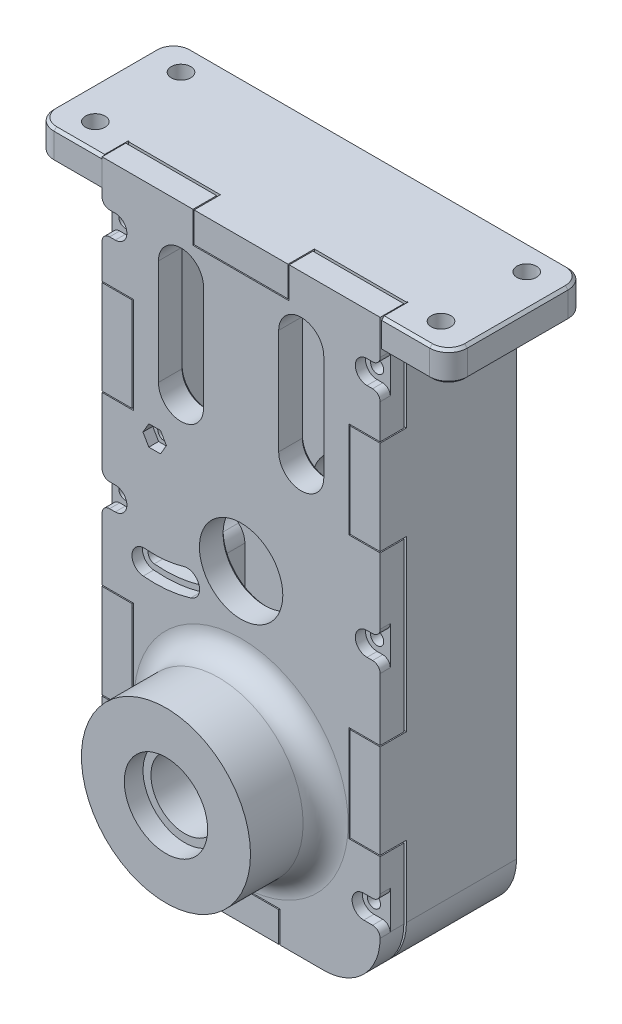
from build123d import *

# Parameters (mm, degrees)
SKETCH1_W            = 42
SKETCH1_H            = 42
BOSS_EXTRUDE1_DEPTH  = 7
SKETCH3_W            = 74
SKETCH3_H            = 158
SKETCH3_W_2          = 58
SKETCH3_H_2          = 142
BOSS_EXTRUDE2_DEPTH  = 30
CUT_EXTRUDE2_REACH   = 138.158
SKETCH4_R            = 9
SKETCH4_5_R          = 11.1
CUT_EXTRUDE3_DEPTH   = 5
CUT_EXTRUDE21_START  = 2
SKETCH4_6_R          = 11.1
SKETCH4_6_R_2        = 9
CUT_EXTRUDE21_DEPTH  = 5
SKETCH5_W            = 8
SKETCH5_H            = 25
SKETCH5_W_2          = 20
SKETCH5_H_2          = 8
SKETCH5_W_3          = 25
BOSS_EXTRUDE4_DEPTH  = 7
BOSS_EXTRUDE5_DEPTH  = 7
BOSS_EXTRUDE15_START = 20
SKETCH28_R           = 22.5
SKETCH28_R_2         = 9
BOSS_EXTRUDE15_DEPTH = 20
CUT_EXTRUDE4_START   = -27
SKETCH8_R            = 9
SKETCH8_R_2          = 11.1
CUT_EXTRUDE4_DEPTH   = 7
SKETCH8_3_R          = 11.1
SKETCH8_3_R_2        = 9
CUT_EXTRUDE5_DEPTH   = 5
SKETCH9_R            = 1.8
CUT_EXTRUDE7_DEPTH   = 7
CUT_EXTRUDE8_DEPTH   = 2.8
CUT_EXTRUDE9_DEPTH   = 2.6
CUT_EXTRUDE10_DEPTH  = 23
FILLET3_R            = 15
FILLET4_R            = 7
FILLET5_R            = 15
SKETCH14_R           = 1.75
CUT_EXTRUDE11_DEPTH  = 2.7
SKETCH14_2_R         = 1.75
CUT_EXTRUDE12_DEPTH  = 7
SKETCH15_R           = 1.5
CUT_EXTRUDE13_DEPTH  = 16
CUT_EXTRUDE14_DEPTH  = 7
FILLET6_R            = 2
SKETCH17_W           = 110
SKETCH17_H           = 29.8
BOSS_EXTRUDE8_DEPTH  = 8
SKETCH18_W           = 17.8
SKETCH18_H           = 8
BOSS_EXTRUDE10_DEPTH = 7
SKETCH19_R           = 2.6
CUT_EXTRUDE15_DEPTH  = 2.5
SKETCH19_3_R         = 2.6
CUT_EXTRUDE16_DEPTH  = 170.629006953
FILLET7_R            = 5
CHAMFER1_SIZE        = 0.7
CHAMFER2_SIZE        = 0.7
FILLET8_R            = 5
FILLET12_R           = 6


with BuildPart() as part:
    # Sketch1 → Boss-Extrude1 (new body)
    # profile 1 of 2: a face of its own
    with BuildSketch(Plane.XY):
        Polygon((21, -21), (-21, -21), (-21, 21), (-29, 21), (-29, -121), (29, -121), (29, 21), (21, 21), align=None)
    # profile 2 of 2: a face of its own
    with BuildSketch(Plane.XY):
        Rectangle(SKETCH1_W, SKETCH1_H)
        with BuildLine():
            ThreePointArc((11.1, 3.5), (0, 14.6), (-11.1, 3.5))
            Line((-11.1, 3.5), (-11.1, -3.5))
            ThreePointArc((-11.1, -3.5), (0, -14.6), (11.1, -3.5))
            Line((11.1, -3.5), (11.1, 3.5))
        make_face(mode=Mode.SUBTRACT)
        with BuildLine():
            ThreePointArc((17.3, -12), (15.5, -10.2), (13.7, -12))
            Line((13.7, -12), (13.7, -19))
            ThreePointArc((13.7, -19), (15.5, -20.8), (17.3, -19))
            Line((17.3, -19), (17.3, -12))
        make_face(mode=Mode.SUBTRACT)
        with BuildLine():
            ThreePointArc((-13.7, -12), (-15.5, -10.2), (-17.3, -12))
            Line((-17.3, -12), (-17.3, -19))
            ThreePointArc((-17.3, -19), (-15.5, -20.8), (-13.7, -19))
            Line((-13.7, -19), (-13.7, -12))
        make_face(mode=Mode.SUBTRACT)
        with BuildLine():
            ThreePointArc((-13.7, 19), (-15.5, 20.8), (-17.3, 19))
            Line((-17.3, 19), (-17.3, 12))
            ThreePointArc((-17.3, 12), (-15.5, 10.2), (-13.7, 12))
            Line((-13.7, 12), (-13.7, 19))
        make_face(mode=Mode.SUBTRACT)
        with BuildLine():
            ThreePointArc((17.3, 19), (15.5, 20.8), (13.7, 19))
            Line((13.7, 19), (13.7, 12))
            ThreePointArc((13.7, 12), (15.5, 10.2), (17.3, 12))
            Line((17.3, 12), (17.3, 19))
        make_face(mode=Mode.SUBTRACT)
    extrude(amount=BOSS_EXTRUDE1_DEPTH)

    # Sketch3 → Boss-Extrude2 (add)
    with BuildSketch(Plane.XY):
        with Locations((0, -50)):
            Rectangle(SKETCH3_W, SKETCH3_H)
        with Locations((0, -50)):
            Rectangle(SKETCH3_W_2, SKETCH3_H_2, mode=Mode.SUBTRACT)
    extrude(amount=BOSS_EXTRUDE2_DEPTH)

    # Sketch4 → Cut-Extrude2 (cut, up to next)
    with BuildSketch(Plane(origin=(0, 0, 7), x_dir=(-1, 0, 0), z_dir=(0, 0, -1)), mode=Mode.PRIVATE) as cut_extrude2_sk1:
        with Locations(Location((0, -92, 0), (0, 0, 180))):
            Circle(SKETCH4_R)
    cut_extrude2_tool1 = extrude(cut_extrude2_sk1.sketch, amount=CUT_EXTRUDE2_REACH, mode=Mode.PRIVATE) & part.part
    # Sketch4 → Cut-Extrude2 (cut, up to next)
    with BuildSketch(Plane(origin=(0, 0, 7), x_dir=(-1, 0, 0), z_dir=(0, 0, -1)), mode=Mode.PRIVATE) as cut_extrude2_sk2:
        with Locations(Location((0, -48, 0), (0, 0, 180))):
            Circle(SKETCH4_R)
    cut_extrude2_tool2 = extrude(cut_extrude2_sk2.sketch, amount=CUT_EXTRUDE2_REACH, mode=Mode.PRIVATE) & part.part
    add(cut_extrude2_tool1.solids().sort_by_distance((0, -92, 7))[0], mode=Mode.SUBTRACT)
    add(cut_extrude2_tool2.solids().sort_by_distance((0, -48, 7))[0], mode=Mode.SUBTRACT)

    # Sketch4<5> → Cut-Extrude3 (cut)
    with BuildSketch(Plane(origin=(0, 0, 7), x_dir=(-1, 0, 0), z_dir=(0, 0, -1))):
        with Locations((0, -48)):
            Circle(SKETCH4_5_R)
    extrude(amount=CUT_EXTRUDE3_DEPTH, mode=Mode.SUBTRACT)

    # Sketch4<6> → Cut-Extrude21 (cut)
    with BuildSketch(Plane(origin=(0, 0, 7), x_dir=(-1, 0, 0), z_dir=(0, 0, -1)).offset(CUT_EXTRUDE21_START)):
        with Locations(Location((0, -92, 0), (0, 0, 180))):
            Circle(SKETCH4_6_R)
        with Locations(Location((0, -92, 0), (0, 0, 180))):
            Circle(SKETCH4_6_R_2, mode=Mode.SUBTRACT)
    extrude(amount=CUT_EXTRUDE21_DEPTH, mode=Mode.SUBTRACT)

    # Sketch5 → Boss-Extrude4 (add)
    with BuildSketch(Plane.XY.offset(30)):
        with Locations((-33, -12.5)):
            Rectangle(SKETCH5_W, SKETCH5_H)
        with Locations((-33, -82.5)):
            Rectangle(SKETCH5_W, SKETCH5_H)
        with Locations((0, -125)):
            Rectangle(SKETCH5_W_2, SKETCH5_H_2)
        with Locations((33, -82.5)):
            Rectangle(SKETCH5_W, SKETCH5_H)
        with Locations((33, -12.5)):
            Rectangle(SKETCH5_W, SKETCH5_H)
        with Locations((0, 25)):
            Rectangle(SKETCH5_W_3, SKETCH5_H_2)
    extrude(amount=BOSS_EXTRUDE4_DEPTH)

    # Sketch12 → Cut-Extrude10 (cut)
    with BuildSketch(Plane.XY.offset(30)):
        with BuildLine():
            Line((-29, -49.5), (-29, -68.5))
            ThreePointArc((-29, -68.5), (-34.454731747, -59), (-29, -49.5))
        make_face()
    extrude(amount=-CUT_EXTRUDE10_DEPTH, mode=Mode.SUBTRACT)

    # Fillet3
    fillet3_edges = [part.edges().sort_by_distance(p)[0] for p in [
        (37, -129, 15),
        (-37, -129, 15),
    ]]
    fillet(fillet3_edges, radius=FILLET3_R)

    # Fillet4
    fillet4_edges = [part.edges().sort_by_distance(p)[0] for p in [
        (-29, -121, 18.5),
        (29, -121, 18.5),
    ]]
    fillet(fillet4_edges, radius=FILLET4_R)

    # Sketch15 → Cut-Extrude13 (cut)
    with BuildSketch(Plane.XY.offset(37)):
        with Locations((33.5, 14.65)):
            Circle(SKETCH15_R)
        with Locations((33.5, -48)):
            Circle(SKETCH15_R)
        with Locations((32.642135624, -109)):
            Circle(SKETCH15_R)
        with Locations((-32.642135624, -109)):
            Circle(SKETCH15_R)
        with Locations((-33.5, -48)):
            Circle(SKETCH15_R)
        with Locations((-33.5, 14.65)):
            Circle(SKETCH15_R)
    extrude(amount=-CUT_EXTRUDE13_DEPTH, mode=Mode.SUBTRACT)

    # Sketch17 → Boss-Extrude8 (add)
    with BuildSketch(Plane(origin=(0, 29, 0), x_dir=(1, 0, 0), z_dir=(0, 1, 0))):
        with Locations((0, -14.9)):
            Rectangle(SKETCH17_W, SKETCH17_H)
    extrude(amount=-BOSS_EXTRUDE8_DEPTH)

    # Sketch18 → Boss-Extrude10 (add)
    with BuildSketch(Plane.XY.offset(29.8)):
        with Locations((-46.1, 25)):
            Rectangle(SKETCH18_W, SKETCH18_H)
        with Locations((46.1, 25)):
            Rectangle(SKETCH18_W, SKETCH18_H)
    extrude(amount=BOSS_EXTRUDE10_DEPTH)

    # Sketch19 → Cut-Extrude15 (cut)
    # profile 1 of 4: a face of its own
    with BuildSketch(Plane.XZ.offset(-21)):
        Polygon((40.457437416, 29.8), (43.228718708, 34.6), (48.771281292, 34.6), (51.542562584, 29.8), (48.771281292, 25), (43.228718708, 25), align=None)
        with Locations(Location((46, 29.8, 0), (0, 0, 270))):
            Circle(SKETCH19_R, mode=Mode.SUBTRACT)
    # profile 2 of 4: a face of its own
    with BuildSketch(Plane.XZ.offset(-21)):
        Polygon((43.228718708, 11.8), (48.771281292, 11.8), (51.542562584, 7), (48.771281292, 2.2), (43.228718708, 2.2), (40.457437416, 7), align=None)
        with Locations(Location((46, 7, 0), (0, 0, 270))):
            Circle(SKETCH19_R, mode=Mode.SUBTRACT)
    # profile 3 of 4: a face of its own
    with BuildSketch(Plane.XZ.offset(-21)):
        Polygon((-43.228718708, 2.2), (-40.457437416, 7), (-43.228718708, 11.8), (-48.771281292, 11.8), (-51.542562584, 7), (-48.771281292, 2.2), align=None)
        with Locations(Location((-46, 7, 0), (0, 0, 270))):
            Circle(SKETCH19_R, mode=Mode.SUBTRACT)
    # profile 4 of 4: a face of its own
    with BuildSketch(Plane.XZ.offset(-21)):
        Polygon((-48.771281292, 25), (-43.228718708, 25), (-40.457437416, 29.8), (-43.228718708, 34.6), (-48.771281292, 34.6), (-51.542562584, 29.8), align=None)
        with Locations(Location((-46, 29.8, 0), (0, 0, 270))):
            Circle(SKETCH19_R, mode=Mode.SUBTRACT)
    extrude(amount=-CUT_EXTRUDE15_DEPTH, mode=Mode.SUBTRACT)

    # Sketch19<3> → Cut-Extrude16 (cut, through all)
    with BuildSketch(Plane.XZ.offset(-21)):
        with Locations(Location((-46, 29.8, 0), (0, 0, 270))):
            Circle(SKETCH19_3_R)
        with Locations(Location((-46, 7, 0), (0, 0, 270))):
            Circle(SKETCH19_3_R)
        with Locations(Location((46, 7, 0), (0, 0, 270))):
            Circle(SKETCH19_3_R)
        with Locations(Location((46, 29.8, 0), (0, 0, 270))):
            Circle(SKETCH19_3_R)
    extrude(amount=-CUT_EXTRUDE16_DEPTH, mode=Mode.SUBTRACT)

    # Fillet7
    fillet7_edges = [part.edges().sort_by_distance(p)[0] for p in [
        (-55, 25, 0),
        (55, 25, 0),
        (55, 25, 36.8),
        (-55, 25, 36.8),
    ]]
    fillet(fillet7_edges, radius=FILLET7_R)

    # Chamfer1
    chamfer1_edges = [part.edges().sort_by_distance(p)[0] for p in [
        (-9, -48, 0),
        (-11.1, -92, 0),
        (37, -46.5, 0),
        (0, -129, 0),
        (-32.606601718, -124.606601718, 0),
        (32.606601718, -124.606601718, 0),
        (-37, -46.5, 0),
        (-43.5, 21, 0),
        (13.7, 15.5, 0),
        (15.5, 10.2, 0),
        (17.3, 15.5, 0),
        (43.6, 21, 36.8),
        (15.5, 20.8, 0),
        (-17.3, 15.5, 0),
        (-43.6, 29, 36.8),
        (-15.5, 10.2, 0),
        (-13.7, 15.5, 0),
        (-15.5, 20.8, 0),
        (-17.3, -15.5, 0),
        (-15.5, -20.8, 0),
        (-13.7, -15.5, 0),
        (-15.5, -10.2, 0),
        (13.7, -15.5, 0),
        (15.5, -20.8, 0),
        (17.3, -15.5, 0),
        (15.5, -10.2, 0),
        (-11.1, 0, 0),
        (0, -14.6, 0),
        (11.1, 0, 0),
        (0, 14.6, 0),
        (55, 29, 18.4),
        (55, 21, 18.4),
        (43.6, 29, 36.8),
        (0, 29, 0),
        (-55, 29, 18.4),
        (-53.535533906, 29, 35.335533906),
        (-53.535533906, 29, 1.464466094),
        (53.535533906, 29, 35.335533906),
        (53.535533906, 29, 1.464466094),
        (43.5, 21, 0),
        (53.535533906, 21, 35.335533906),
        (53.535533906, 21, 1.464466094),
        (-55, 21, 18.4),
        (-43.6, 21, 36.8),
        (-53.535533906, 21, 35.335533906),
        (-53.535533906, 21, 1.464466094),
    ]]
    chamfer(chamfer1_edges, length=CHAMFER1_SIZE)

    # Fillet8
    fillet8_edges = [part.edges().sort_by_distance(p)[0] for p in [
        (-29, -49.5, 18.5),
        (-29, -68.5, 18.5),
    ]]
    fillet(fillet8_edges, radius=FILLET8_R)


with BuildPart() as body_2:
    # Sketch7 → Boss-Extrude5 (new body)
    with BuildSketch(Plane.XY.offset(30)):
        Polygon((-37, -129), (-10.3, -129), (-10.3, -120.7), (10.3, -120.7), (10.3, -129), (37, -129), (37, -95.3), (28.7, -95.3), (28.7, -69.7), (37, -69.7), (37, -25.3), (28.7, -25.3), (28.7, 0.3), (37, 0.3), (37, 29), (12.8, 29), (12.8, 20.7), (-12.8, 20.7), (-12.8, 29), (-37, 29), (-37, 0.3), (-28.7, 0.3), (-28.7, -25.3), (-37, -25.3), (-37, -69.7), (-28.7, -69.7), (-28.7, -95.3), (-37, -95.3), align=None)
    extrude(amount=BOSS_EXTRUDE5_DEPTH)

    # Sketch28 → Boss-Extrude15 (add)
    with BuildSketch(Plane.XY.offset(37).offset(BOSS_EXTRUDE15_START)):
        with Locations((0, -92)):
            Circle(SKETCH28_R)
        with Locations((0, -92)):
            Circle(SKETCH28_R_2, mode=Mode.SUBTRACT)
    extrude(amount=-BOSS_EXTRUDE15_DEPTH)

    # Sketch8 → Cut-Extrude4 (cut)
    with BuildSketch(Plane.XY.offset(57).offset(CUT_EXTRUDE4_START)):
        with Locations((0, -92)):
            Circle(SKETCH8_R)
        with Locations((0, -48)):
            Circle(SKETCH8_R_2)
    extrude(amount=CUT_EXTRUDE4_DEPTH, mode=Mode.SUBTRACT)

    # Sketch8<3> → Cut-Extrude5 (cut)
    with BuildSketch(Plane.XY.offset(57)):
        with Locations((0, -92)):
            Circle(SKETCH8_3_R)
        with Locations((0, -92)):
            Circle(SKETCH8_3_R_2, mode=Mode.SUBTRACT)
    extrude(amount=-CUT_EXTRUDE5_DEPTH, mode=Mode.SUBTRACT)

    # Sketch9 → Cut-Extrude7 (cut)
    with BuildSketch(Plane.XY.offset(37)):
        with BuildLine():
            ThreePointArc((-25.915736751, -60.666046157), (-19.82, -60.6406005), (-13.841114362, -59.452500946))
            ThreePointArc((-13.841114362, -59.452500946), (-12.635815382, -57.210346989), (-14.87796934, -56.005048009))
            ThreePointArc((-14.87796934, -56.005048009), (-20.18, -57.058645726), (-25.585653345, -57.081210743))
            ThreePointArc((-25.585653345, -57.081210743), (-27.543112755, -58.708586747), (-25.915736751, -60.666046157))
        make_face()
        with Locations((-23, -29)):
            Circle(SKETCH9_R)
    extrude(amount=-CUT_EXTRUDE7_DEPTH, mode=Mode.SUBTRACT)

    # Sketch10 → Cut-Extrude8 (cut)
    with BuildSketch(Plane.XY.offset(37)):
        with BuildLine():
            ThreePointArc((-26.053271504, -62.159727579), (-19.67, -62.133081656), (-13.409091455, -60.88893967))
            ThreePointArc((-13.409091455, -60.88893967), (-11.199376659, -56.778324081), (-15.309992247, -54.568609285))
            ThreePointArc((-15.309992247, -54.568609285), (-20.33, -55.566164571), (-25.448118593, -55.58752932))
            ThreePointArc((-25.448118593, -55.58752932), (-29.036794178, -58.571051994), (-26.053271504, -62.159727579))
        make_face()
    extrude(amount=-CUT_EXTRUDE8_DEPTH, mode=Mode.SUBTRACT)

    # Sketch11 → Cut-Extrude9 (cut)
    with BuildSketch(Plane.XY.offset(37)):
        Polygon((-21.441154273, -26.3), (-24.558845727, -26.3), (-26.117691454, -29), (-24.558845727, -31.7), (-21.441154273, -31.7), (-19.882308546, -29), align=None)
    extrude(amount=-CUT_EXTRUDE9_DEPTH, mode=Mode.SUBTRACT)

    # Fillet5
    fillet5_edges = [body_2.edges().sort_by_distance(p)[0] for p in [
        (37, -129, 33.5),
        (-37, -129, 33.5),
    ]]
    fillet(fillet5_edges, radius=FILLET5_R)

    # Sketch14 → Cut-Extrude11 (cut)
    # profile 1 of 6: a face of its own
    with BuildSketch(Plane.XY.offset(37)):
        with BuildLine():
            Line((33.5, -44.9), (40.5, -44.9))
            ThreePointArc((40.5, -44.9), (43.6, -48), (40.5, -51.1))
            Line((40.5, -51.1), (33.5, -51.1))
            ThreePointArc((33.5, -51.1), (30.4, -48), (33.5, -44.9))
        make_face()
        with Locations((33.5, -48)):
            Circle(SKETCH14_R, mode=Mode.SUBTRACT)
    # profile 2 of 6: a face of its own
    with BuildSketch(Plane.XY.offset(37)):
        with BuildLine():
            Line((32.642135624, -105.9), (39.642135624, -105.9))
            ThreePointArc((39.642135624, -105.9), (42.742135624, -109), (39.642135624, -112.1))
            Line((39.642135624, -112.1), (32.642135624, -112.1))
            ThreePointArc((32.642135624, -112.1), (29.542135624, -109), (32.642135624, -105.9))
        make_face()
        with Locations((32.642135624, -109)):
            Circle(SKETCH14_R, mode=Mode.SUBTRACT)
    # profile 3 of 6: a face of its own
    with BuildSketch(Plane.XY.offset(37)):
        with BuildLine():
            Line((-33.5, -44.9), (-40.5, -44.9))
            ThreePointArc((-40.5, -44.9), (-43.6, -48), (-40.5, -51.1))
            Line((-40.5, -51.1), (-33.5, -51.1))
            ThreePointArc((-33.5, -51.1), (-30.4, -48), (-33.5, -44.9))
        make_face()
        with Locations((-33.5, -48)):
            Circle(SKETCH14_R, mode=Mode.SUBTRACT)
    # profile 4 of 6: a face of its own
    with BuildSketch(Plane.XY.offset(37)):
        with BuildLine():
            Line((33.5, 17.75), (40.5, 17.75))
            ThreePointArc((40.5, 17.75), (43.6, 14.65), (40.5, 11.55))
            Line((40.5, 11.55), (33.5, 11.55))
            ThreePointArc((33.5, 11.55), (30.4, 14.65), (33.5, 17.75))
        make_face()
        with Locations((33.5, 14.65)):
            Circle(SKETCH14_R, mode=Mode.SUBTRACT)
    # profile 5 of 6: a face of its own
    with BuildSketch(Plane.XY.offset(37)):
        with BuildLine():
            Line((-32.642135624, -105.9), (-39.642135624, -105.9))
            ThreePointArc((-39.642135624, -105.9), (-42.742135624, -109), (-39.642135624, -112.1))
            Line((-39.642135624, -112.1), (-32.642135624, -112.1))
            ThreePointArc((-32.642135624, -112.1), (-29.542135624, -109), (-32.642135624, -105.9))
        make_face()
        with Locations((-32.642135624, -109)):
            Circle(SKETCH14_R, mode=Mode.SUBTRACT)
    # profile 6 of 6: a face of its own
    with BuildSketch(Plane.XY.offset(37)):
        with BuildLine():
            Line((-33.5, 17.75), (-40.5, 17.75))
            ThreePointArc((-40.5, 17.75), (-43.6, 14.65), (-40.5, 11.55))
            Line((-40.5, 11.55), (-33.5, 11.55))
            ThreePointArc((-33.5, 11.55), (-30.4, 14.65), (-33.5, 17.75))
        make_face()
        with Locations((-33.5, 14.65)):
            Circle(SKETCH14_R, mode=Mode.SUBTRACT)
    extrude(amount=-CUT_EXTRUDE11_DEPTH, mode=Mode.SUBTRACT)

    # Sketch14<2> → Cut-Extrude12 (cut)
    with BuildSketch(Plane.XY.offset(37)):
        with Locations((-32.642135624, -109)):
            Circle(SKETCH14_2_R)
        with Locations((-33.5, -48)):
            Circle(SKETCH14_2_R)
        with Locations((-33.5, 14.65)):
            Circle(SKETCH14_2_R)
        with Locations((33.5, 14.65)):
            Circle(SKETCH14_2_R)
        with Locations((33.5, -48)):
            Circle(SKETCH14_2_R)
        with Locations((32.642135624, -109)):
            Circle(SKETCH14_2_R)
    extrude(amount=-CUT_EXTRUDE12_DEPTH, mode=Mode.SUBTRACT)

    # Sketch16 → Cut-Extrude14 (cut)
    with BuildSketch(Plane.XY.offset(37)):
        with BuildLine():
            Line((-10, 12.5), (-10, -15.5))
            ThreePointArc((-10, -15.5), (-16, -21.5), (-22, -15.5))
            Line((-22, -15.5), (-22, 12.5))
            ThreePointArc((-22, 12.5), (-16, 18.5), (-10, 12.5))
        make_face()
        with BuildLine():
            Line((10, 12.5), (10, -15.5))
            ThreePointArc((10, -15.5), (16, -21.5), (22, -15.5))
            Line((22, -15.5), (22, 12.5))
            ThreePointArc((22, 12.5), (16, 18.5), (10, 12.5))
        make_face()
    extrude(amount=-CUT_EXTRUDE14_DEPTH, mode=Mode.SUBTRACT)

    # Fillet6
    # the kernel refuses this fillet: 2 mm, written as the material it takes off along each edge
    with BuildSketch(Plane(origin=(-37, 11.55, 42), x_dir=(0, -1, 0), z_dir=(0, 0, -1)), Plane(origin=(-37, 17.75, 34.3), x_dir=(0, 1, 0), z_dir=(0, 0, 1)), Plane(origin=(-37, -105.9, 34.3), x_dir=(0, 1, 0), z_dir=(0, 0, 1)), Plane(origin=(-37, -51.1, 42), x_dir=(0, -1, 0), z_dir=(0, 0, -1)), Plane(origin=(-37, -44.9, 34.3), x_dir=(0, 1, 0), z_dir=(0, 0, 1))) as fillet6_piece_1:
        with BuildLine():
            CenterArc((FILLET6_R, -FILLET6_R), FILLET6_R, 90, 90)
            Line((0, -FILLET6_R), (0, 0))
            Line((0, 0), (FILLET6_R, 0))
        make_face()
    extrude(amount=7.7, mode=Mode.SUBTRACT)
    with BuildSketch(Plane(origin=(37, -105.9, 34.3), x_dir=(0, 1, 0), z_dir=(0, 0, 1)), Plane(origin=(37, 17.75, 34.3), x_dir=(0, 1, 0), z_dir=(0, 0, 1)), Plane(origin=(37, 11.55, 42), x_dir=(0, -1, 0), z_dir=(0, 0, -1)), Plane(origin=(37, -44.9, 34.3), x_dir=(0, 1, 0), z_dir=(0, 0, 1)), Plane(origin=(37, -51.1, 42), x_dir=(0, -1, 0), z_dir=(0, 0, -1))) as fillet6_piece_2:
        with BuildLine():
            CenterArc((FILLET6_R, FILLET6_R), FILLET6_R, 180, 90)
            Line((0, FILLET6_R), (0, 0))
            Line((0, 0), (FILLET6_R, 0))
        make_face()
    extrude(amount=7.7, mode=Mode.SUBTRACT)
    with BuildSketch(Plane(origin=(37, -112.1, 42.038461661), x_dir=(-0.0002202028998266684, -0.9999999757553413, 0), z_dir=(0, 0, -1))) as fillet6_piece_3:
        with BuildLine():
            CenterArc((2.000440442, 1.999944167), FILLET6_R, 179.987383303, 90.440741112)
            Line((0.00044049, 2.000384573), (-0.199559505, 2.000428613))
            Line((-0.199559505, 2.000428613), (-0.199999995, 4.4041e-05))
            Line((-0.199999995, 4.4041e-05), (-4.4041e-05, -0.199999995))
            ThreePointArc((-4.4041e-05, -0.199999995), (1.899955913, -0.200418381), (2.016879086, -0.199994417))
            Line((2.016879086, -0.199994417), (2.015384664, 0))
        make_face()
    extrude(amount=7.738461661, mode=Mode.SUBTRACT)
    with BuildSketch(Plane(origin=(-37, -112.1, 42.038461661), x_dir=(0.0002202028998301955, -0.999999975755341, 0), z_dir=(0, 0, -1))) as fillet6_piece_4:
        with BuildLine():
            CenterArc((2.000440442, -1.999944167), FILLET6_R, 89.571875585, 90.440741112)
            Line((0.00044049, -2.000384573), (-0.199559505, -2.000428613))
            Line((-0.199559505, -2.000428613), (-0.199999995, -4.4041e-05))
            Line((-0.199999995, -4.4041e-05), (-4.4041e-05, 0.199999995))
            ThreePointArc((-4.4041e-05, 0.199999995), (1.899955913, 0.200418381), (2.016879086, 0.199994417))
            Line((2.016879086, 0.199994417), (2.015384664, 0))
        make_face()
    extrude(amount=7.738461661, mode=Mode.SUBTRACT)

    # Chamfer2
    chamfer2_edges = [body_2.edges().sort_by_distance(p)[0] for p in [
        (-19.82, -60.6406005, 30),
        (-27.543112755, -58.708586747, 30),
        (-12.635815382, -57.210346989, 30),
        (-20.18, -57.058645726, 30),
        (-24.8, -29, 30),
        (37, -104.65, 30),
        (-16.15, -129, 30),
        (-32.606601718, -124.606601718, 30),
        (32.606601718, -124.606601718, 30),
        (-12.8, 24.85, 30),
        (0, 20.7, 30),
        (12.8, 24.85, 30),
        (24.9, 29, 30),
        (37, 14.65, 30),
        (32.85, 0.3, 30),
        (28.7, -12.5, 30),
        (32.85, -25.3, 30),
        (37, -47.5, 30),
        (30.892135624, -109, 30),
        (31.75, -48, 30),
        (31.75, 14.65, 30),
        (32.85, -69.7, 30),
        (-35.25, 14.65, 30),
        (-35.25, -48, 30),
        (28.7, -82.5, 30),
        (-34.392135624, -109, 30),
        (32.85, -95.3, 30),
        (16.15, -129, 30),
        (10.3, -124.85, 30),
        (-16, 18.5, 30),
        (-10, -1.5, 30),
        (-16, -21.5, 30),
        (-22, -1.5, 30),
        (0, -120.7, 30),
        (16, 18.5, 30),
        (22, -1.5, 30),
        (16, -21.5, 30),
        (10, -1.5, 30),
        (-10.3, -124.85, 30),
        (-37, -104.65, 30),
        (-32.85, -95.3, 30),
        (-28.7, -82.5, 30),
        (-32.85, -69.7, 30),
        (-37, -47.5, 30),
        (-32.85, -25.3, 30),
        (-28.7, -12.5, 30),
        (-32.85, 0.3, 30),
        (-37, 14.65, 30),
        (-24.9, 29, 30),
        (-11.1, -48, 30),
        (-9, -92, 30),
    ]]
    chamfer(chamfer2_edges, length=CHAMFER2_SIZE)

    # Fillet12
    fillet12_edges = [body_2.edges().sort_by_distance(p)[0] for p in [
        (-22.5, -92, 37),
    ]]
    fillet(fillet12_edges, radius=FILLET12_R)


solid = Compound([part.part, body_2.part])
